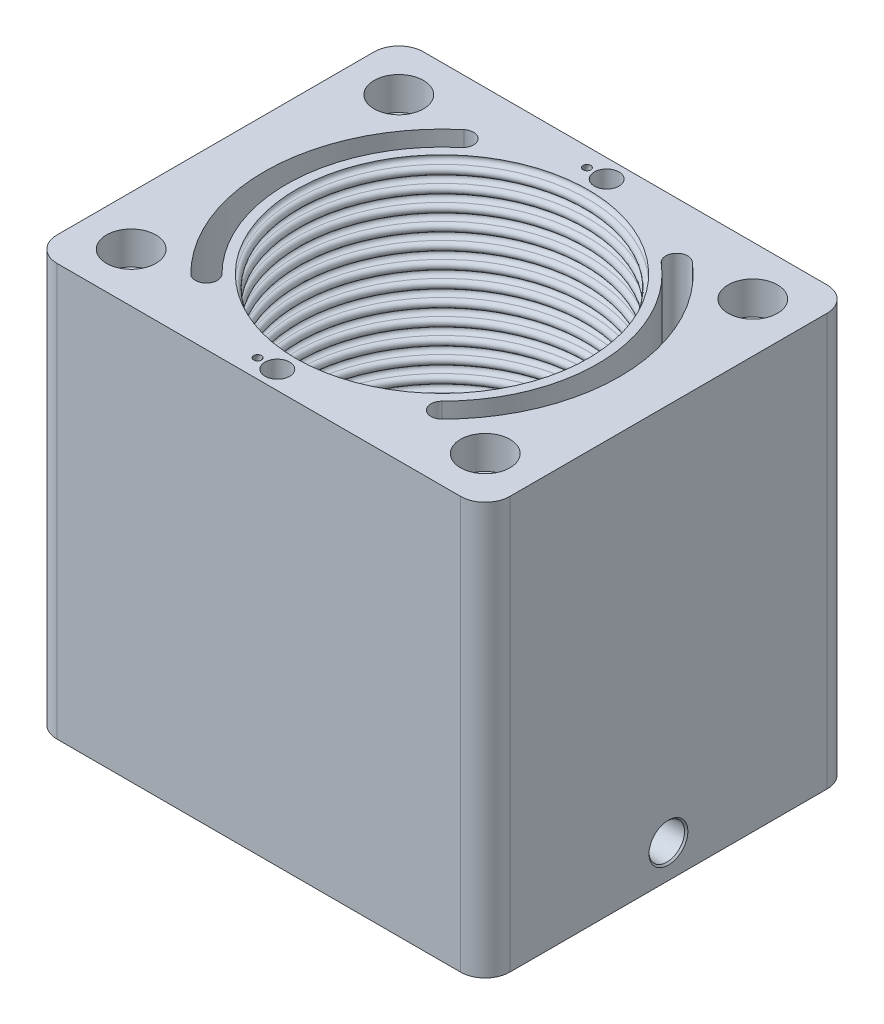
from build123d import *

# Parameters (mm, degrees)
SKETCH3_W           = 174.625
SKETCH3_H           = 141.2875
SKETCH3_R           = 57.94375
BOSS_EXTRUDE1_DEPTH = 158.8897
FILLET1_R           = 9.525
SKETCH4_R           = 6.35
CUT_EXTRUDE1_DEPTH  = 195.576331645
SKETCH5_R           = 9.525
CUT_EXTRUDE2_DEPTH  = 12.7
LPATTERN1_COUNT     = 24
LPATTERN1_PITCH     = 6.35
CUT_EXTRUDE3_DEPTH  = 195.576331645
SKETCH15_R          = 4.7625
CUT_EXTRUDE4_DEPTH  = 9.525
SKETCH18_R          = 8.334375
CUT_EXTRUDE5_DEPTH  = 6.35


with BuildPart() as part:
    # Sketch3 → Boss-Extrude1 (new body)
    with BuildSketch(Plane(origin=(0, 0, 0), x_dir=(1, 0, 0), z_dir=(0, 1, 0))):
        Rectangle(SKETCH3_W, SKETCH3_H)
        with Locations(Location((0, 0, 0), (0, 0, 270))):
            Circle(SKETCH3_R, mode=Mode.SUBTRACT)
    extrude(amount=BOSS_EXTRUDE1_DEPTH)

    # Fillet1
    fillet1_edges = [part.edges().sort_by_distance(p)[0] for p in [
        (87.3125, 79.44485, 70.64375),
        (-87.3125, 79.44485, 70.64375),
        (-87.3125, 79.44485, -70.64375),
        (87.3125, 79.44485, -70.64375),
    ]]
    fillet(fillet1_edges, radius=FILLET1_R)

    # Sketch4 → Cut-Extrude1 (cut, through all)
    with BuildSketch(Plane.XZ):
        with Locations(Location((-68.2625, -51.59375, 0), (0, 0, 270))):
            Circle(SKETCH4_R)
        with Locations(Location((-68.2625, 51.59375, 0), (0, 0, 270))):
            Circle(SKETCH4_R)
        with Locations(Location((68.2625, 51.59375, 0), (0, 0, 270))):
            Circle(SKETCH4_R)
        with Locations(Location((68.2625, -51.59375, 0), (0, 0, 270))):
            Circle(SKETCH4_R)
    extrude(amount=-CUT_EXTRUDE1_DEPTH, mode=Mode.SUBTRACT)

    # Sketch5 → Cut-Extrude2 (cut)
    with BuildSketch(Plane(origin=(0, 158.8897, 0), x_dir=(1, 0, 0), z_dir=(0, 1, 0))):
        with Locations(Location((68.2625, 51.59375, 0), (0, 0, 270))):
            Circle(SKETCH5_R)
        with Locations(Location((68.2625, -51.59375, 0), (0, 0, 270))):
            Circle(SKETCH5_R)
        with Locations(Location((-68.2625, -51.59375, 0), (0, 0, 270))):
            Circle(SKETCH5_R)
        with Locations(Location((-68.2625, 51.59375, 0), (0, 0, 270))):
            Circle(SKETCH5_R)
    extrude(amount=-CUT_EXTRUDE2_DEPTH, mode=Mode.SUBTRACT)

    # Sketch6 → Revolve1 (revolve)
    with BuildSketch(Plane(origin=(0, 0, 0), x_dir=(0, 0, -1), z_dir=(1, 0, 0)), mode=Mode.PRIVATE) as revolve1_sk:
        with BuildLine():
            ThreePointArc((56.35625, 155.7147), (54.76875, 154.1272), (56.35625, 152.5397))
            Line((56.35625, 152.5397), (57.94375, 152.5397))
            Line((57.94375, 152.5397), (57.94375, 157.3022))
            ThreePointArc((57.94375, 157.3022), (57.478782015, 156.179667985), (56.35625, 155.7147))
        make_face()
        with BuildLine():
            ThreePointArc((56.35625, 158.8897), (57.478782015, 158.424732015), (57.94375, 157.3022))
            Line((57.94375, 157.3022), (57.94375, 158.8897))
            Line((57.94375, 158.8897), (56.35625, 158.8897))
        make_face()
    revolve1 = revolve(revolve1_sk.sketch.rotate(Axis((0, 158.8897, 0), (0, -1, 0)), 180), axis=Axis((0, 158.8897, 0), (0, -1, 0)))

    # LPattern1: Revolve1 ×24
    with Locations(*[(0, -i * LPATTERN1_PITCH, 0) for i in range(1, LPATTERN1_COUNT)]):
        add(revolve1)

    # Sketch7 → Revolve2 (revolve)
    with BuildSketch(Plane(origin=(0, 0, 0), x_dir=(0, 0, -1), z_dir=(1, 0, 0)), mode=Mode.PRIVATE) as revolve2_sk:
        with BuildLine():
            Line((57.94375, 6.4897), (56.35625, 6.4897))
            ThreePointArc((56.35625, 6.4897), (57.478782015, 6.024732015), (57.94375, 4.9022))
            Line((57.94375, 4.9022), (57.94375, 6.4897))
        make_face()
        with BuildLine():
            Line((57.94375, 0), (57.94375, 4.9022))
            ThreePointArc((57.94375, 4.9022), (57.478782015, 3.779667985), (56.35625, 3.3147))
            ThreePointArc((56.35625, 3.3147), (55.233717985, 2.849732015), (54.76875, 1.7272))
            Line((54.76875, 1.7272), (54.76875, 0))
            Line((54.76875, 0), (57.94375, 0))
        make_face()
    revolve(revolve2_sk.sketch.rotate(Axis((0, 0, 0), (0, 1, 0)), 180), axis=Axis((0, 0, 0), (0, 1, 0)))

    # Sketch9 → Cut-Extrude3 (cut, through all)
    with BuildSketch(Plane(origin=(0, 158.8897, 0), x_dir=(1, 0, 0), z_dir=(0, 1, 0))):
        with BuildLine():
            ThreePointArc((42.426429781, -42.426429781), (59.942925664, 2.617164655), (38.567277408, 45.962691407))
            ThreePointArc((38.567277408, 45.962691407), (38.043435583, 51.950230865), (44.03097504, 52.47407269))
            ThreePointArc((44.03097504, 52.47407269), (68.434840133, 2.987929648), (48.436840667, -48.436840667))
            ThreePointArc((48.436840667, -48.436840667), (42.426429781, -48.436840667), (42.426429781, -42.426429781))
        make_face()
        with BuildLine():
            ThreePointArc((-44.03097504, 52.47407269), (-38.043435583, 51.950230865), (-38.567277408, 45.962691407))
            ThreePointArc((-38.567277408, 45.962691407), (-59.942925664, 2.617164655), (-42.426429781, -42.426429781))
            ThreePointArc((-42.426429781, -42.426429781), (-42.426429781, -48.436840667), (-48.436840667, -48.436840667))
            ThreePointArc((-48.436840667, -48.436840667), (-68.434840133, 2.987929648), (-44.03097504, 52.47407269))
        make_face()
    extrude(amount=-CUT_EXTRUDE3_DEPTH, mode=Mode.SUBTRACT)

    # Cut-Sweep1: sweep along a path in Sketch12
    with BuildLine(Plane.XZ) as cut_sweep1_path:
        ThreePointArc((-41.299126224, -49.218382048), (0, -64.250034695), (41.299126224, -49.218382048))
    # Sketch11 → Cut-Sweep1 (sweep, cut)
    with BuildSketch(Plane(origin=(0, 0, 0), x_dir=(0, 0, -1), z_dir=(1, 0, 0))):
        with BuildLine():
            Line((60.0000324, 12.7), (60.0000324, 0))
            Line((60.0000324, 0), (68.00003672, 0))
            Line((68.00003672, 0), (68.00003672, 12.7))
            ThreePointArc((68.00003672, 12.7), (64.00003456, 16.70000216), (60.0000324, 12.7))
        make_face()
    sweep(path=cut_sweep1_path.line, mode=Mode.SUBTRACT)

    # 1/4 NPT Tapped Hole1: read off the stored shape, not the designer's step
    # 1/4 NPT Tapped Hole1 outline → 1/4 NPT Tapped Hole1 (revolve, cut)
    with BuildSketch(Plane(origin=(0, 12.7, 0), x_dir=(0, 1, 0), z_dir=(0, 0, -1))):
        Polygon((0, 68.27374754), (5.5626, 68.27374754), (5.5626, 77.2922), (6.576991549, 77.2922), (6.858, 86.6775), (7.493, 87.3125), (0, 87.3125), align=None)
    revolve(axis=Axis((0, 12.7, 0), (1, 0, 0)), mode=Mode.SUBTRACT)

    # Sketch15 → Cut-Extrude4 (cut)
    with BuildSketch(Plane(origin=(0, 158.8897, 0), x_dir=(1, 0, 0), z_dir=(0, 1, 0))):
        with Locations(Location((0, 63.5, 0), (0, 0, 270))):
            Circle(SKETCH15_R)
        with Locations(Location((0, -63.5, 0), (0, 0, 270))):
            Circle(SKETCH15_R)
    extrude(amount=-CUT_EXTRUDE4_DEPTH, mode=Mode.SUBTRACT)

    # Cut-Loft1: read off the stored shape, not the designer's step
    # Cut-Loft1: loft between two sections, ruled curve by curve
    cut_loft1_from = [
        Edge.make_bspline([(-9.112204908, 158.8897, -63.361701514), (-9.123729782, 158.8897, -63.486051923), (-9.12164571, 158.8897, -63.62811853), (-9.060834867, 158.8897, -63.941983125), (-9.001367573, 158.8897, -64.114451753), (-8.792118464, 158.8897, -64.454916558), (-8.640566817, 158.8897, -64.622276863), (-8.247917484, 158.8897, -64.880862635), (-8.006999305, 158.8897, -64.969155161), (-7.509597668, 158.8897, -65.015254656), (-7.256556438, 158.8897, -64.972742599), (-6.823071566, 158.8897, -64.790723462), (-6.643343396, 158.8897, -64.654066379), (-6.375086934, 158.8897, -64.35785709), (-6.284935816, 158.8897, -64.199255189), (-6.167477913, 158.8897, -63.901912654), (-6.139319965, 158.8897, -63.762648895), (-6.116270218, 158.8897, -63.513948077), (-6.11835429, 158.8897, -63.37188147), (-6.179165133, 158.8897, -63.058016875), (-6.238632427, 158.8897, -62.885548247), (-6.447881536, 158.8897, -62.545083442), (-6.599433183, 158.8897, -62.377723137), (-6.992082516, 158.8897, -62.119137365), (-7.233000695, 158.8897, -62.030844839), (-7.730402332, 158.8897, -61.984745344), (-7.983443562, 158.8897, -62.027257401), (-8.416928434, 158.8897, -62.209276538), (-8.596656604, 158.8897, -62.345933621), (-8.864913066, 158.8897, -62.64214291), (-8.955064184, 158.8897, -62.800744811), (-9.072522087, 158.8897, -63.098087346), (-9.100680035, 158.8897, -63.237351105), (-9.112204908, 158.8897, -63.361701514)], [0, 0, 0, 0, 0.0625, 0.0625, 0.125, 0.125, 0.1875, 0.1875, 0.25, 0.25, 0.3125, 0.3125, 0.375, 0.375, 0.4375, 0.4375, 0.5, 0.5, 0.5625, 0.5625, 0.625, 0.625, 0.6875, 0.6875, 0.75, 0.75, 0.8125, 0.8125, 0.875, 0.875, 0.9375, 0.9375, 1, 1, 1, 1], 3),
    ]
    cut_loft1_to = [
        Edge.make_bspline([(-76.110795144, 0, -63.46977385), (-76.11331399, 0, -63.594631778), (-76.100980585, 0, -63.736177359), (-76.017672737, 0, -64.044833713), (-75.945911295, 0, -64.212559926), (-75.712632317, 0, -64.537032407), (-75.549395465, 0, -64.693016711), (-75.139104937, 0, -64.922585402), (-74.892442008, 0, -64.993257453), (-74.393010293, 0, -65.003332836), (-74.143697782, 0, -64.942666443), (-73.724482347, 0, -64.729831954), (-73.555087309, 0, -64.580558064), (-73.30891184, 0, -64.26575795), (-73.230444223, 0, -64.101062413), (-73.134755744, 0, -63.796017076), (-73.116723701, 0, -63.655084079), (-73.11168601, 0, -63.405368222), (-73.124019415, 0, -63.263822641), (-73.207327263, 0, -62.955166287), (-73.279088705, 0, -62.787440074), (-73.512367683, 0, -62.462967593), (-73.675604535, 0, -62.306983289), (-74.085895063, 0, -62.077414598), (-74.332557992, 0, -62.006742547), (-74.831989707, 0, -61.996667164), (-75.081302218, 0, -62.057333557), (-75.500517653, 0, -62.270168046), (-75.669912691, 0, -62.419441936), (-75.91608816, 0, -62.73424205), (-75.994555777, 0, -62.898937587), (-76.090244256, 0, -63.203982924), (-76.108276299, 0, -63.344915921), (-76.110795144, 0, -63.46977385)], [0, 0, 0, 0, 0.0625, 0.0625, 0.125, 0.125, 0.1875, 0.1875, 0.25, 0.25, 0.3125, 0.3125, 0.375, 0.375, 0.4375, 0.4375, 0.5, 0.5, 0.5625, 0.5625, 0.625, 0.625, 0.6875, 0.6875, 0.75, 0.75, 0.8125, 0.8125, 0.875, 0.875, 0.9375, 0.9375, 1, 1, 1, 1], 3),
    ]
    cut_loft1 = Solid(Shell([*[Face.make_surface_from_curves(cut_loft1_from[k], cut_loft1_to[k]) for k in range(1)], Face(Wire(cut_loft1_from)), Face(Wire(cut_loft1_to))]))
    add(cut_loft1, mode=Mode.SUBTRACT)

    # Mirror2: Cut-Loft1 across plane
    add(cut_loft1.mirror(Plane.XY), mode=Mode.SUBTRACT)

    # Sketch18 → Cut-Extrude5 (cut)
    with BuildSketch(Plane(origin=(0, 0, 0), x_dir=(-1, 0, 0), z_dir=(0, -1, 0))):
        with Locations(Location((-68.2625, -51.59375, 0), (0, 0, 90))):
            Circle(SKETCH18_R)
        with Locations(Location((-68.2625, 51.59375, 0), (0, 0, 90))):
            Circle(SKETCH18_R)
        with Locations(Location((68.2625, -51.59375, 0), (0, 0, 90))):
            Circle(SKETCH18_R)
        with Locations(Location((68.2625, 51.59375, 0), (0, 0, 90))):
            Circle(SKETCH18_R)
    extrude(amount=-CUT_EXTRUDE5_DEPTH, mode=Mode.SUBTRACT)


solid = part.part
